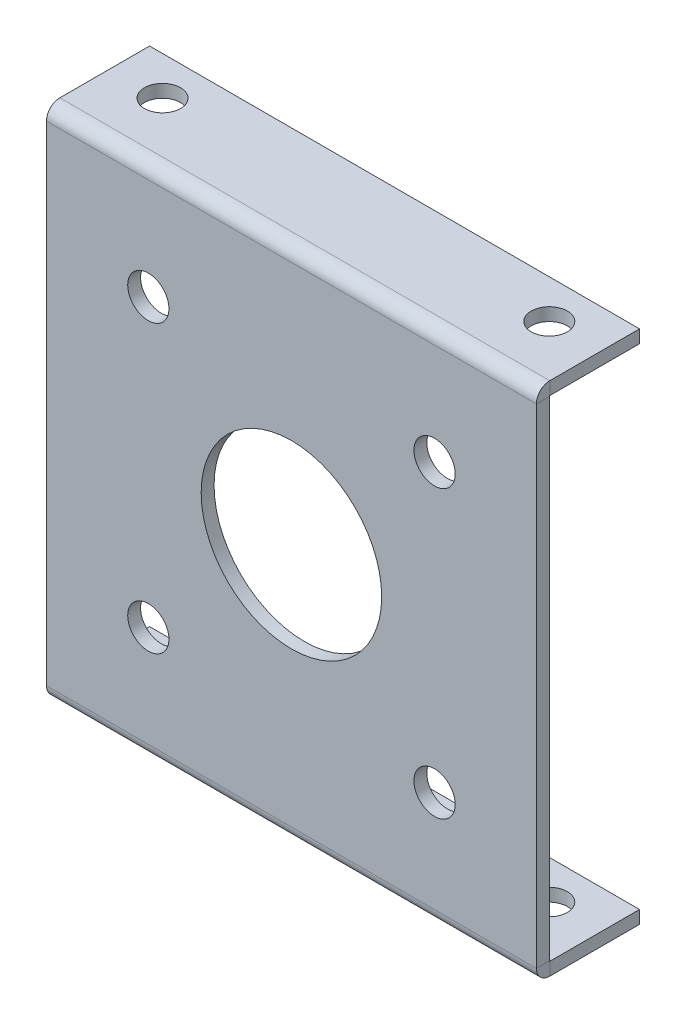
from build123d import *

# Parameters (mm, degrees)
SKETCH1_W                    = 190
SKETCH1_H                    = 200
BASE_FLANGE1_DEPTH           = 5
EDGE_FLANGE1_STRIP_W         = 20.4
EDGE_FLANGE1_STRIP_H         = 5
EDGE_FLANGE1_STRIP_CUT_DEPTH = 190
EDGE_FLANGE1_DEPTH           = 190
EDGE_FLANGE2_STRIP_W         = 20.4
EDGE_FLANGE2_STRIP_H         = 5
EDGE_FLANGE2_STRIP_CUT_DEPTH = 190
EDGE_FLANGE2_DEPTH           = 190
CUT_EXTRUDE1_DEPTH           = 144.614066163
CUT_EXTRUDE1_DEPTH_BACK      = 144.614066163
SKETCH12_R                   = 35
CUT_EXTRUDE2_DEPTH           = 144.614066163
CUT_EXTRUDE2_DEPTH_BACK      = 144.614066163
SKETCH13_R                   = 8
CUT_EXTRUDE3_DEPTH           = 226
CUT_EXTRUDE3_DEPTH_BACK      = 226
SKETCH14_R                   = 7


# Sheet-metal steps are written as plain solids
with BuildPart() as part:
    # Sketch1 → Base-Flange1 (new body)
    with BuildSketch(Plane.XY):
        Rectangle(SKETCH1_W, SKETCH1_H)
    extrude(amount=-BASE_FLANGE1_DEPTH)

    # Edge-Flange1 strip (across the edge) → Edge-Flange1 strip cut (cut)
    with BuildSketch(Plane(origin=(-95, 100, -5), x_dir=(0, -1, 0), z_dir=(1, 0, 0))):
        with Locations((-5, -2.5)):
            Rectangle(EDGE_FLANGE1_STRIP_W, EDGE_FLANGE1_STRIP_H)
    extrude(amount=EDGE_FLANGE1_STRIP_CUT_DEPTH, mode=Mode.SUBTRACT)

    # Edge-Flange1 section (across the edge) → Edge-Flange1 (add)
    with BuildSketch(Plane(origin=(-95, 100, -5), x_dir=(0, -1, 0), z_dir=(1, 0, 0))):
        with BuildLine():
            Line((0, 0.2), (0, 35))
            Line((0, 35), (5, 35))
            Line((5, 35), (5, 0.2))
            ThreePointArc((5, 0.2), (5.058578644, 0.058578644), (5.2, 0))
            Line((5.2, 0), (5.2, -5))
            ThreePointArc((5.2, -5), (1.523044738, -3.476955262), (0, 0.2))
        make_face()
    extrude(amount=EDGE_FLANGE1_DEPTH)

    # Edge-Flange2 strip (across the edge) → Edge-Flange2 strip cut (cut)
    with BuildSketch(Plane(origin=(95, -100, -5), x_dir=(0, 1, 0), z_dir=(-1, 0, 0))):
        with Locations((-5, -2.5)):
            Rectangle(EDGE_FLANGE2_STRIP_W, EDGE_FLANGE2_STRIP_H)
    extrude(amount=EDGE_FLANGE2_STRIP_CUT_DEPTH, mode=Mode.SUBTRACT)

    # Edge-Flange2 section (across the edge) → Edge-Flange2 (add)
    with BuildSketch(Plane(origin=(95, -100, -5), x_dir=(0, 1, 0), z_dir=(-1, 0, 0))):
        with BuildLine():
            Line((0, 0.2), (0, 35))
            Line((0, 35), (5, 35))
            Line((5, 35), (5, 0.2))
            ThreePointArc((5, 0.2), (5.058578644, 0.058578644), (5.2, 0))
            Line((5.2, 0), (5.2, -5))
            ThreePointArc((5.2, -5), (1.523044738, -3.476955262), (0, 0.2))
        make_face()
    extrude(amount=EDGE_FLANGE2_DEPTH)

    # Sketch12 → Cut-Extrude1 (cut, two sides: drawn at the far end of the back side and taken through both)
    with BuildSketch(Plane.XY.offset(-CUT_EXTRUDE1_DEPTH_BACK)):
        with Locations(Location((0, 0, 0), (0, 0, 180))):
            Circle(SKETCH12_R)
    extrude(amount=CUT_EXTRUDE1_DEPTH + CUT_EXTRUDE1_DEPTH_BACK, mode=Mode.SUBTRACT)

    # Sketch13 → Cut-Extrude2 (cut, two sides: drawn at the far end of the back side and taken through both)
    with BuildSketch(Plane.XY.offset(-CUT_EXTRUDE2_DEPTH_BACK)):
        with Locations(Location((55.5, 55.5, 0), (0, 0, 180))):
            Circle(SKETCH13_R)
        with Locations(Location((-55.5, 55.5, 0), (0, 0, 180))):
            Circle(SKETCH13_R)
        with Locations(Location((-55.5, -55.5, 0), (0, 0, 180))):
            Circle(SKETCH13_R)
        with Locations(Location((55.5, -55.5, 0), (0, 0, 180))):
            Circle(SKETCH13_R)
    extrude(amount=CUT_EXTRUDE2_DEPTH + CUT_EXTRUDE2_DEPTH_BACK, mode=Mode.SUBTRACT)

    # Sketch14 → Cut-Extrude3 (cut, two sides: drawn at the far end of the back side and taken through both)
    with BuildSketch(Plane(origin=(0, -100, 0), x_dir=(-1, 0, 0), z_dir=(0, -1, 0)).offset(-CUT_EXTRUDE3_DEPTH_BACK)):
        with Locations(Location((75, 25, 0), (0, 0, 270))):
            Circle(SKETCH14_R)
        with Locations(Location((-75, 25, 0), (0, 0, 270))):
            Circle(SKETCH14_R)
    extrude(amount=CUT_EXTRUDE3_DEPTH + CUT_EXTRUDE3_DEPTH_BACK, mode=Mode.SUBTRACT)


solid = part.part
